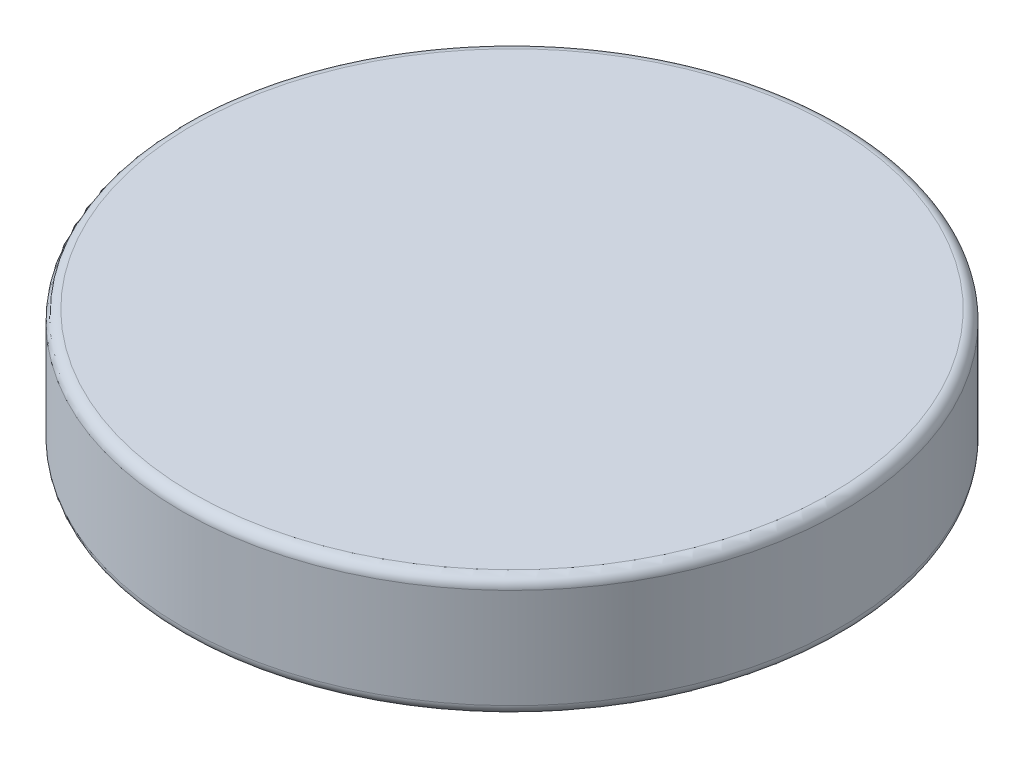
from build123d import *

# Parameters (mm, degrees)
SKETCH1_R           = 15.9385
BOSS_EXTRUDE1_DEPTH = 5.842
FILLET1_R           = 0.508


with BuildPart() as part:
    # Sketch1 → Boss-Extrude1 (new body)
    with BuildSketch(Plane(origin=(0, 0, 0), x_dir=(1, 0, 0), z_dir=(0, 1, 0))):
        Circle(SKETCH1_R)
    extrude(amount=BOSS_EXTRUDE1_DEPTH)

    # Fillet1
    fillet1_edges = [part.edges().sort_by_distance(p)[0] for p in [
        (-15.9385, 0, 0),
        (-15.9385, 5.842, 0),
    ]]
    fillet(fillet1_edges, radius=FILLET1_R)


solid = part.part
